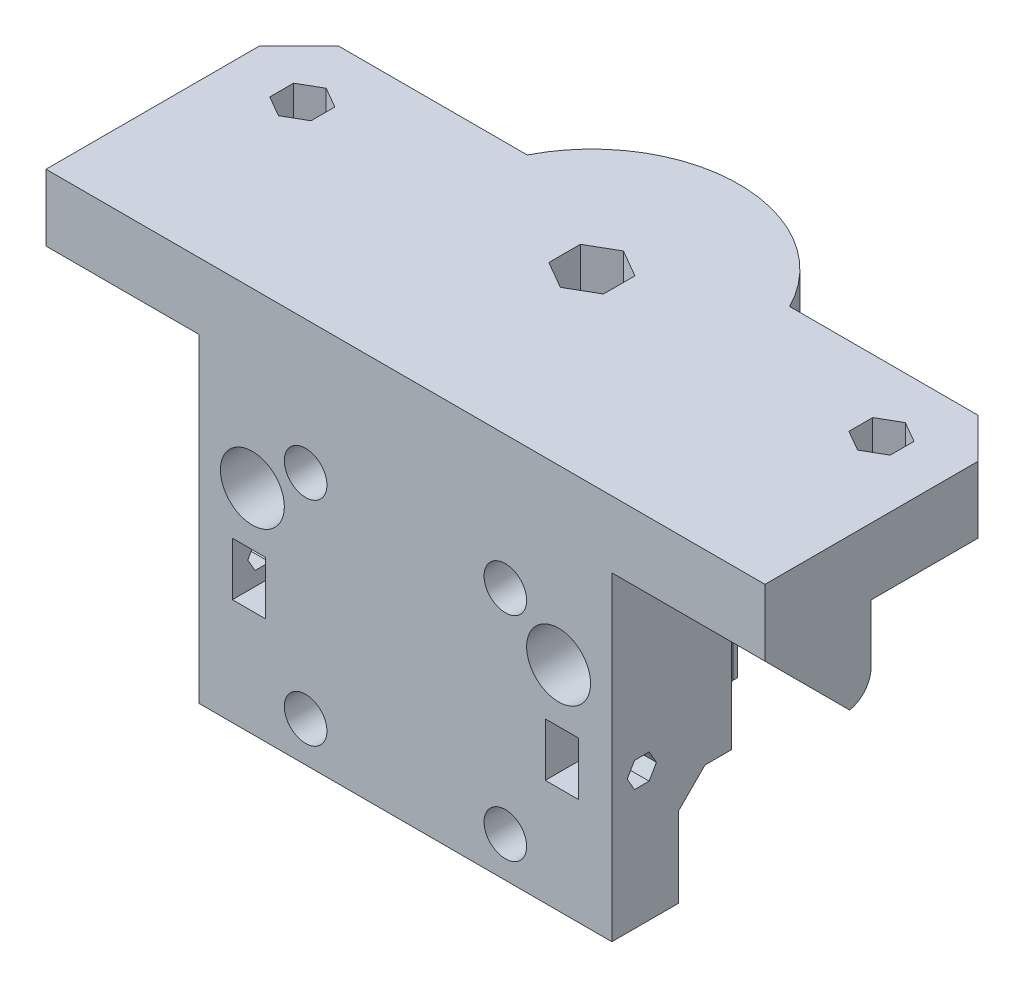
from build123d import *

# Parameters (mm, degrees)
SKETCH1_R             = 11.05
SKETCH1_R_2           = 8.05
BOSS_EXTRUDE1_DEPTH   = 7.1
BOSS_EXTRUDE2_START   = 5.9
SKETCH2_R             = 11.05
SKETCH2_R_2           = 6.05
BOSS_EXTRUDE2_DEPTH   = 5.9
BOSS_EXTRUDE3_START   = 3
SKETCH3_R             = 11.05
SKETCH3_R_2           = 8.05
BOSS_EXTRUDE3_DEPTH   = 3
BOSS_EXTRUDE5_DEPTH   = 5
BOSS_EXTRUDE6_START   = -28
BOSS_EXTRUDE6_DEPTH   = 28
SKETCH7_R             = 1.6
CUT_EXTRUDE1_DEPTH    = 10
SKETCH19_R            = 2.25
CUT_EXTRUDE12_DEPTH   = 7.2
CUT_EXTRUDE2_DEPTH    = 7
SKETCH11_W            = 69.093947153
SKETCH11_H            = 34.466141574
CUT_EXTRUDE4_DEPTH    = 35.696109338
CHAMFER_START         = -8.9
CHAMFER_1_DEPTH       = 16
CHAMFER_START_2       = -10.7999999
CHAMFER_1_2_DEPTH     = 1.8999999
CHAMFER_START_3       = -11.229918485
CHAMFER_1_3_DEPTH     = 0.429918585
CHAMFER_START_4       = 1
CHAMFER_1_4_OUTLINE_R = 1.6
CHAMFER_1_4_DEPTH     = 4
SKETCH12_R            = 1.65
CUT_EXTRUDE5_DEPTH    = 41.748159507
SKETCH13_R            = 2.4
CUT_EXTRUDE6_DEPTH    = 5.2
CUT_EXTRUDE11_DEPTH   = 2.2
SKETCH20_W            = 31
SKETCH20_H            = 7
CUT_EXTRUDE13_DEPTH   = 3
SKETCH25_W            = 11.5
SKETCH25_H            = 5
BOSS_EXTRUDE7_DEPTH   = 3.3
SKETCH_1_W            = 31
SKETCH_1_H            = 21
CUT_EXTRUDE_1_DEPTH   = 1
SKETCH_2_W            = 47.798523665
SKETCH_2_H            = 25.617179173
CUT_EXTRUDE_2_DEPTH   = 7
SKETCH_3_W            = 31
SKETCH_3_H            = 5
EXTRUDE_1_DEPTH       = 8
SKETCH_4_R            = 1.6
CUT_EXTRUDE_3_DEPTH   = 41.522987304
SKETCH_5_R            = 11.5
CUT_EXTRUDE_4_DEPTH   = 8
SKETCH_6_R            = 2.9
CUT_EXTRUDE_5_DEPTH   = 7
SKETCH_7_R            = 2.9
CUT_EXTRUDE_6_DEPTH   = 2.5
CHAMFER_2_SIZE        = 3
CHAMFER_5_SIZE        = 0.8
CHAMFER_6_SIZE        = 2
SKETCH_8_W            = 11.5
SKETCH_8_H            = 5
EXTRUDE_2_DEPTH       = 5.7
EXTRUDE_4_REACH       = 60.289
SKETCH_15_W           = 11.5
SKETCH_15_H           = 1.6
EXTRUDE_6_DEPTH       = 6.36
CUT_EXTRUDE_7_DEPTH   = 2.8
CUT_EXTRUDE_9_DEPTH   = 5
SKETCH_16_W           = 2.5
SKETCH_16_H           = 4
CUT_EXTRUDE_10_DEPTH  = 4.5
CHAMFER_8_SIZE        = 1.25
MIRROR_START          = -15.5
MIRROR_1_DEPTH        = 4.84796
MIRROR_START_2        = -19.06571985
MIRROR_1_2_DEPTH      = 3.56571985
MIRROR_START_3        = -27
MIRROR_1_3_DEPTH      = 1.9
MIRROR_START_4        = -17.06571985
MIRROR_1_4_DEPTH      = 1.56571985
MIRROR_1_5_DEPTH      = 1.9602
MIRROR_START_5        = -8.9
MIRROR_1_6_DEPTH      = 4
MIRROR_START_6        = 0.74
MIRROR_1_7_OUTLINE_W  = 5.97408015
MIRROR_1_7_OUTLINE_H  = 7.963961031
MIRROR_1_7_DEPTH      = 6.36
MIRROR_START_7        = 0.736412811
MIRROR_1_8_OUTLINE_W  = 5.97408015
MIRROR_1_8_OUTLINE_H  = 6.363961031
MIRROR_1_8_DEPTH      = 0.003587189
MIRROR_START_8        = -21.849599539
MIRROR_1_9_OUTLINE_W  = 5.97408015
MIRROR_1_9_OUTLINE_H  = 12
MIRROR_1_9_DEPTH      = 16.970562749
MIRROR_START_9        = -4.87903679
MIRROR_1_10_DEPTH     = 2.8
MIRROR_1_11_DEPTH     = 2.8
FILLET_4_R            = 2
CHAMFER_7_SIZE        = 1.8


with BuildPart() as part:
    # Sketch1 → Boss-Extrude1 (new body)
    with BuildSketch(Plane(origin=(0, 0, 0), x_dir=(1, 0, 0), z_dir=(0, 1, 0))):
        with Locations(Location((0, 0, 0), (0, 0, 270))):
            Circle(SKETCH1_R)
        with Locations(Location((0, 0, 0), (0, 0, 270))):
            Circle(SKETCH1_R_2, mode=Mode.SUBTRACT)
    extrude(amount=BOSS_EXTRUDE1_DEPTH)

    # Sketch2 → Boss-Extrude2 (add)
    with BuildSketch(Plane(origin=(0, 0, 0), x_dir=(-1, 0, 0), z_dir=(0, -1, 0)).offset(BOSS_EXTRUDE2_START)):
        with Locations(Location((0, 0, 0), (0, 0, 90))):
            Circle(SKETCH2_R)
        with Locations(Location((0, 0, 0), (0, 0, 90))):
            Circle(SKETCH2_R_2, mode=Mode.SUBTRACT)
    extrude(amount=-BOSS_EXTRUDE2_DEPTH)

    # Sketch3 → Boss-Extrude3 (add)
    with BuildSketch(Plane(origin=(0, -5.9, 0), x_dir=(-1, 0, 0), z_dir=(0, -1, 0)).offset(BOSS_EXTRUDE3_START)):
        with Locations(Location((0, 0, 0), (0, 0, 90))):
            Circle(SKETCH3_R)
        with Locations(Location((0, 0, 0), (0, 0, 270))):
            Circle(SKETCH3_R_2, mode=Mode.SUBTRACT)
    extrude(amount=-BOSS_EXTRUDE3_DEPTH)

    # Sketch5 → Boss-Extrude5 (add)
    with BuildSketch(Plane(origin=(0, 7.1, 0), x_dir=(1, 0, 0), z_dir=(0, 1, 0))):
        with BuildLine():
            Line((27, 5), (9.854060077, 5))
            ThreePointArc((9.854060077, 5), (0, 11.05), (-9.854060077, 5))
            Line((-9.854060077, 5), (-27, 5))
            Line((-27, 5), (-27, -5))
            Line((-27, -5), (-9.854060077, -5))
            ThreePointArc((-9.854060077, -5), (0, -11.05), (9.854060077, -5))
            Line((9.854060077, -5), (27, -5))
            Line((27, -5), (27, 5))
        make_face()
        Polygon((23.3, 0.894892917), (23.3, -0.894892917), (21.75, -1.789785834), (20.2, -0.894892917), (20.2, 0.894892917), (21.75, 1.789785834), align=None, mode=Mode.SUBTRACT)
        Polygon((0, -2.367136104), (-2.05, -1.183568052), (-2.05, 1.183568052), (0, 2.367136104), (2.05, 1.183568052), (2.05, -1.183568052), align=None, mode=Mode.SUBTRACT)
        Polygon((-20.2, 0.894892917), (-20.2, -0.894892917), (-21.75, -1.789785834), (-23.3, -0.894892917), (-23.3, 0.894892917), (-21.75, 1.789785834), align=None, mode=Mode.SUBTRACT)
    extrude(amount=BOSS_EXTRUDE5_DEPTH)

    # Sketch6 → Boss-Extrude6 (add)
    with BuildSketch(Plane(origin=(0, 12.1, 0), x_dir=(1, 0, 0), z_dir=(0, 1, 0)).offset(BOSS_EXTRUDE6_START)):
        with BuildLine():
            Line((-15.5, -5), (-9.854060077, -5))
            ThreePointArc((-9.854060077, -5), (0, -11.05), (9.854060077, -5))
            Line((9.854060077, -5), (15.5, -5))
            Line((15.5, -5), (15.5, -15))
            Line((15.5, -15), (-15.5, -15))
            Line((-15.5, -15), (-15.5, -5))
        make_face()
    extrude(amount=BOSS_EXTRUDE6_DEPTH)

    # Sketch7 → Cut-Extrude1 (cut)
    with BuildSketch(Plane.XY.offset(15)):
        with Locations((-12, -12.4)):
            Circle(SKETCH7_R)
        with Locations((12, -12.4)):
            Circle(SKETCH7_R)
    extrude(amount=-CUT_EXTRUDE1_DEPTH, mode=Mode.SUBTRACT)

    # Sketch19 → Cut-Extrude12 (cut)
    with BuildSketch(Plane.XY.offset(15)):
        with Locations((-12, -12.4)):
            Circle(SKETCH19_R)
        with Locations((12, -12.4)):
            Circle(SKETCH19_R)
    extrude(amount=-CUT_EXTRUDE12_DEPTH, mode=Mode.SUBTRACT)

    # Sketch8 → Cut-Extrude2 (cut)
    with BuildSketch(Plane(origin=(0, -15.9, 0), x_dir=(-1, 0, 0), z_dir=(0, -1, 0))):
        with BuildLine():
            Line((-8, -8.94427191), (-8, -15))
            Line((-8, -15), (8, -15))
            Line((8, -15), (8, -8.94427191))
            ThreePointArc((8, -8.94427191), (0, -12), (-8, -8.94427191))
        make_face()
        with BuildLine():
            Line((-8, -7.62249959), (-8, -8.94427191))
            ThreePointArc((-8, -8.94427191), (0, -12), (8, -8.94427191))
            Line((8, -8.94427191), (8, -7.62249959))
            ThreePointArc((8, -7.62249959), (0, -11.05), (-8, -7.62249959))
        make_face()
        with BuildLine():
            Line((-8, -5), (-8, -7.62249959))
            ThreePointArc((-8, -7.62249959), (0, -11.05), (8, -7.62249959))
            Line((8, -7.62249959), (8, -5))
            Line((8, -5), (-8, -5))
        make_face()
        with BuildLine():
            ThreePointArc((-10.908712115, -5), (-9.657855284, -7.122206913), (-8, -8.94427191))
            Line((-8, -8.94427191), (-8, -7.62249959))
            ThreePointArc((-8, -7.62249959), (-9.022817816, -6.378970032), (-9.854060077, -5))
            Line((-9.854060077, -5), (-10.908712115, -5))
        make_face()
        with BuildLine():
            Line((8, -7.62249959), (8, -8.94427191))
            ThreePointArc((8, -8.94427191), (9.657855284, -7.122206913), (10.908712115, -5))
            Line((10.908712115, -5), (9.854060077, -5))
            ThreePointArc((9.854060077, -5), (9.022817816, -6.378970032), (8, -7.62249959))
        make_face()
    extrude(amount=-CUT_EXTRUDE2_DEPTH, mode=Mode.SUBTRACT)

    # Sketch11 → Cut-Extrude4 (cut, through all)
    with BuildSketch(Plane.XY.offset(0.1)):
        with Locations((-0.795033035, -10.133070787)):
            Rectangle(SKETCH11_W, SKETCH11_H)
    extrude(amount=-CUT_EXTRUDE4_DEPTH, mode=Mode.SUBTRACT)

    # 倒角1: read off the stored shape, not the designer's step
    # 倒角1 outline → 倒角1 (add)
    with BuildSketch(Plane(origin=(0, 0, 0), x_dir=(1, 0, 0), z_dir=(0, 1, 0)).offset(CHAMFER_START)):
        with BuildLine():
            Line((12.999631207, -5), (11.040598985, -0.455712685))
            ThreePointArc((11.040598985, -0.455712685), (10.691554196, -2.791624773), (9.854060077, -5))
            Line((9.854060077, -5), (12.999631207, -5))
        make_face()
        with BuildLine():
            ThreePointArc((-9.854060077, -5), (-10.441635038, -3.615903448), (-10.835862618, -2.164851341))
            Line((-10.835862618, -2.164851341), (-15.21279225, -5))
            Line((-15.21279225, -5), (-9.854060077, -5))
        make_face()
    extrude(amount=CHAMFER_1_DEPTH)

    # Chamfer 1 2 outline → Chamfer 1 2 (add)
    with BuildSketch(Plane(origin=(0, 0, 0), x_dir=(1, 0, 0), z_dir=(0, 1, 0)).offset(CHAMFER_START_2)):
        with BuildLine():
            Line((12.999631207, -5), (11.795384696, -2.206558379))
            ThreePointArc((11.795384696, -2.206558379), (11.43764976, -3.630450108), (10.908712115, -5))
            Line((10.908712115, -5), (12.999631207, -5))
        make_face()
    extrude(amount=CHAMFER_1_2_DEPTH)

    # Chamfer 1 3 outline → Chamfer 1 3 (add)
    with BuildSketch(Plane(origin=(0, 0, 0), x_dir=(1, 0, 0), z_dir=(0, 1, 0)).offset(CHAMFER_START_3)):
        with BuildLine():
            Line((12.999631207, -5), (11.795384696, -2.206558379))
            ThreePointArc((11.795384696, -2.206558379), (11.43764976, -3.630450108), (10.908712115, -5))
            Line((10.908712115, -5), (12.999631207, -5))
        make_face()
    extrude(amount=CHAMFER_1_3_DEPTH)

    # Chamfer 1 4 outline → Chamfer 1 4 (cut)
    with BuildSketch(Plane.XY.offset(CHAMFER_START_4)):
        with Locations((12, -12.4)):
            Circle(CHAMFER_1_4_OUTLINE_R)
    extrude(amount=CHAMFER_1_4_DEPTH, mode=Mode.SUBTRACT)

    # Sketch12 → Cut-Extrude5 (cut, through all)
    with BuildSketch(Plane.XY.offset(15)):
        with Locations((-11.5, -0.9)):
            Circle(SKETCH12_R)
        with Locations((11.5, -0.9)):
            Circle(SKETCH12_R)
    extrude(amount=-CUT_EXTRUDE5_DEPTH, mode=Mode.SUBTRACT)

    # Sketch13 → Cut-Extrude6 (cut)
    with BuildSketch(Plane.XY.offset(15)):
        with Locations((-11.5, -0.9)):
            Circle(SKETCH13_R)
        with Locations((11.5, -0.9)):
            Circle(SKETCH13_R)
    extrude(amount=-CUT_EXTRUDE6_DEPTH, mode=Mode.SUBTRACT)

    # Sketch18 → Cut-Extrude11 (cut)
    with BuildSketch(Plane(origin=(0, 7.1, 0), x_dir=(-1, 0, 0), z_dir=(0, -1, 0))):
        Polygon((-18.95, 1.616580754), (-21.75, 3.233161507), (-24.55, 1.616580754), (-24.55, -1.616580754), (-21.75, -3.233161507), (-18.95, -1.616580754), align=None)
        Polygon((24.55, -1.678715419), (24.55, 1.554446088), (21.75, 3.171026842), (18.95, 1.554446088), (18.95, -1.678715419), (21.75, -3.295296173), align=None)
    extrude(amount=-CUT_EXTRUDE11_DEPTH, mode=Mode.SUBTRACT)

    # Sketch20 → Cut-Extrude13 (cut)
    with BuildSketch(Plane.XY.offset(15)):
        with Locations((0, -12.4)):
            Rectangle(SKETCH20_W, SKETCH20_H)
    extrude(amount=-CUT_EXTRUDE13_DEPTH, mode=Mode.SUBTRACT)

    # Sketch25 → Boss-Extrude7 (add)
    with BuildSketch(Plane.XY.offset(5)):
        with Locations((21.25, 9.6)):
            Rectangle(SKETCH25_W, SKETCH25_H)
        with Locations((-21.25, 9.6)):
            Rectangle(SKETCH25_W, SKETCH25_H)
    extrude(amount=BOSS_EXTRUDE7_DEPTH)

    # 草图1 → 切除-拉伸1 (cut)
    with BuildSketch(Plane.XY.offset(15)):
        with Locations((0, 1.6)):
            Rectangle(SKETCH_1_W, SKETCH_1_H)
    extrude(amount=-CUT_EXTRUDE_1_DEPTH, mode=Mode.SUBTRACT)

    # 草图2 → 切除-拉伸2 (cut)
    with BuildSketch(Plane(origin=(0, -15.9, 0), x_dir=(-1, 0, 0), z_dir=(0, -1, 0))):
        with Locations((-1.111593574, -6.563303387)):
            Rectangle(SKETCH_2_W, SKETCH_2_H)
    extrude(amount=-CUT_EXTRUDE_2_DEPTH, mode=Mode.SUBTRACT)

    # 草图3 → 凸台-拉伸1 (add)
    with BuildSketch(Plane(origin=(0, -8.9, 0), x_dir=(-1, 0, 0), z_dir=(0, -1, 0))):
        with Locations((0, -11.5)):
            Rectangle(SKETCH_3_W, SKETCH_3_H)
    extrude(amount=EXTRUDE_1_DEPTH)

    # 草图4 → 切除-拉伸3 (cut, through all)
    with BuildSketch(Plane.XY.offset(14)):
        with Locations((-7.5, 2.1)):
            Circle(SKETCH_4_R)
        with Locations((7.5, 2.1)):
            Circle(SKETCH_4_R)
        with Locations((7.5, -13.9)):
            Circle(SKETCH_4_R)
        with Locations((-7.5, -13.9)):
            Circle(SKETCH_4_R)
    extrude(amount=-CUT_EXTRUDE_3_DEPTH, mode=Mode.SUBTRACT)

    # 草图5 → 切除-拉伸4 (cut)
    with BuildSketch(Plane(origin=(0, -16.9, 0), x_dir=(-1, 0, 0), z_dir=(0, -1, 0))):
        Circle(SKETCH_5_R)
    extrude(amount=-CUT_EXTRUDE_4_DEPTH, mode=Mode.SUBTRACT)

    # 草图6 → 切除-拉伸5 (cut)
    with BuildSketch(Plane(origin=(0, 0, 0.1), x_dir=(-1, 0, 0), z_dir=(0, 0, -1))):
        with Locations((7.5, 2.1)):
            Circle(SKETCH_6_R)
        with Locations((-7.5, 2.1)):
            Circle(SKETCH_6_R)
    extrude(amount=-CUT_EXTRUDE_5_DEPTH, mode=Mode.SUBTRACT)

    # 草图7 → 切除-拉伸6 (cut)
    with BuildSketch(Plane(origin=(0, 0, 9), x_dir=(-1, 0, 0), z_dir=(0, 0, -1))):
        with Locations((-7.5, -13.9)):
            Circle(SKETCH_7_R)
        with Locations((7.5, -13.9)):
            Circle(SKETCH_7_R)
    extrude(amount=-CUT_EXTRUDE_6_DEPTH, mode=Mode.SUBTRACT)

    # 倒角2
    chamfer_2_edges = [part.edges().sort_by_distance(p)[0] for p in [
        (-27, 9.6, -5),
        (27, 9.6, -5),
    ]]
    chamfer(chamfer_2_edges, length=CHAMFER_2_SIZE)

    # 倒角5
    # the kernel refuses this chamfer: 0.8 mm, written as the material it takes off along each edge
    with BuildSketch(Plane(origin=(-11.5, -0.9, 9.8), x_dir=(1, 0, 0), z_dir=(0, -1, 0))) as chamfer_5_piece_1_section:
        Polygon((1.65, -CHAMFER_5_SIZE), (1.65 + CHAMFER_5_SIZE, 0), (1.65, 0), align=None)
    chamfer_5_piece_1 = revolve(axis=Axis((-11.5, -0.9, 9.8), (0, 0, 1)), mode=Mode.PRIVATE)
    chamfer_5_piece_1 = chamfer_5_piece_1 & Plane(origin=(-11.5, -0.9, 9.8), x_dir=(1, 0, 0), z_dir=(0, 0, 1)) * Cylinder(2.4, 10, mode=Mode.PRIVATE)
    add(chamfer_5_piece_1, mode=Mode.SUBTRACT)
    with BuildSketch(Plane(origin=(11.5, -0.9, 9.8), x_dir=(1, 0, 0), z_dir=(0, -1, 0))) as chamfer_5_piece_2_section:
        Polygon((1.65, -CHAMFER_5_SIZE), (1.65 + CHAMFER_5_SIZE, 0), (1.65, 0), align=None)
    chamfer_5_piece_2 = revolve(axis=Axis((11.5, -0.9, 9.8), (0, 0, 1)), mode=Mode.PRIVATE)
    chamfer_5_piece_2 = chamfer_5_piece_2 & Plane(origin=(11.5, -0.9, 9.8), x_dir=(1, 0, 0), z_dir=(0, 0, 1)) * Cylinder(2.4, 10, mode=Mode.PRIVATE)
    add(chamfer_5_piece_2, mode=Mode.SUBTRACT)

    # 倒角6
    chamfer_6_edges = [part.edges().sort_by_distance(p)[0] for p in [
        (-11.329455266, -8.9, 9),
        (11.329455266, -8.9, 9),
    ]]
    chamfer(chamfer_6_edges, length=CHAMFER_6_SIZE)

    # 草图8 → 凸台-拉伸2 (add)
    with BuildSketch(Plane.XY.offset(8.3)):
        with Locations((21.25, 9.6)):
            Rectangle(SKETCH_8_W, SKETCH_8_H)
        with Locations((-21.25, 9.6)):
            Rectangle(SKETCH_8_W, SKETCH_8_H)
    extrude(amount=EXTRUDE_2_DEPTH)

    # 草图10 → 凸台-拉伸4 (add, up to next)
    with BuildSketch(Plane(origin=(27, 0, 0), x_dir=(0, 0, -1), z_dir=(1, 0, 0)), mode=Mode.PRIVATE) as extrude_4_sk1:
        Polygon((-14, 7.1), (-7.636038969, 0.736038969), (-7.636038969, 7.1), align=None)
    extrude_4_tool1 = extrude(extrude_4_sk1.sketch, amount=-EXTRUDE_4_REACH, mode=Mode.PRIVATE) - part.part
    add(extrude_4_tool1.solids().sort_by_distance((27, 4.97868, 9.757359))[0])

    # 草图15 → 凸台-拉伸6 (add)
    with BuildSketch(Plane(origin=(0, 7.1, 0), x_dir=(-1, 0, 0), z_dir=(0, -1, 0))):
        with Locations((-21.25, -6.836038969)):
            Rectangle(SKETCH_15_W, SKETCH_15_H)
    extrude(amount=EXTRUDE_6_DEPTH)

    # 草图11 → 切除-拉伸7 (cut)
    with BuildSketch(Plane(origin=(0, -3.45, 3.45), x_dir=(-1, 0, 0), z_dir=(0, -0.7071067811865562, 0.7071067811865389))):
        with BuildLine():
            Line((-19.06571985, -9.919953083), (-17.06571985, -9.919953083))
            Line((-17.06571985, -9.919953083), (-17.06571985, -11.919953083))
            Line((-17.06571985, -11.919953083), (-19.06571985, -11.919953083))
            ThreePointArc((-19.06571985, -11.919953083), (-25.1, -10.919953083), (-19.06571985, -9.919953083))
        make_face()
    extrude(amount=-CUT_EXTRUDE_7_DEPTH, mode=Mode.SUBTRACT)

    # 草图14 → 切除-拉伸9 (cut)
    with BuildSketch(Plane(origin=(15.5, 0, 0), x_dir=(0, 0, -1), z_dir=(1, 0, 0))):
        Polygon((-10.653034489, -6.9), (-11.201517244, -5.95), (-12.298482756, -5.95), (-12.846965511, -6.9), (-12.298482756, -7.85), (-11.201517244, -7.85), align=None)
    extrude(amount=-CUT_EXTRUDE_9_DEPTH, mode=Mode.SUBTRACT)

    # 草图16 → 切除-拉伸10 (cut)
    with BuildSketch(Plane.XY.offset(14)):
        with Locations((11.75, -6.9)):
            Rectangle(SKETCH_16_W, SKETCH_16_H)
    extrude(amount=-CUT_EXTRUDE_10_DEPTH, mode=Mode.SUBTRACT)

    # 倒角8
    # the kernel refuses this chamfer: 1.25 mm, written as the material it adds along each edge
    with BuildSketch(Plane(origin=(10.5, -12.114603735, 9.5), x_dir=(0, 0, 1), z_dir=(0, 1, 0))) as chamfer_8_piece_1:
        Polygon((CHAMFER_8_SIZE, 0), (0, CHAMFER_8_SIZE), (0, 0), align=None)
    extrude(amount=7.214603735)
    with BuildSketch(Plane(origin=(13, -4.9, 9.5), x_dir=(0, 0, 1), z_dir=(0, -1, 0))) as chamfer_8_piece_2_section:
        Polygon((CHAMFER_8_SIZE, 0), (0, CHAMFER_8_SIZE), (0, 0), align=None)
    chamfer_8_piece_2 = extrude(amount=7.214603735, mode=Mode.PRIVATE)
    chamfer_8_piece_2 = split(chamfer_8_piece_2, bisect_by=Plane(origin=(13, -5.899278579, 11.23080127), z_dir=(0, 0.5000000000000002, -0.8660254037844386)), keep=Keep.TOP, mode=Mode.PRIVATE)
    add(chamfer_8_piece_2)
    with BuildSketch(Plane(origin=(13, -1.685396265, 9.5), x_dir=(0, 0, 1), z_dir=(0, -1, 0))) as chamfer_8_piece_3_section:
        Polygon((CHAMFER_8_SIZE, 0), (0, CHAMFER_8_SIZE), (0, 0), align=None)
    chamfer_8_piece_3 = extrude(amount=10.42920747, mode=Mode.PRIVATE)
    chamfer_8_piece_3 = split(chamfer_8_piece_3, bisect_by=Plane(origin=(13, -2.48976862, 8.106786214), z_dir=(0, -0.49999999999999895, -0.8660254037844393)), keep=Keep.TOP, mode=Mode.PRIVATE)
    add(chamfer_8_piece_3)

    # 镜向1: read off the stored shape, not the designer's step
    # 镜向1 outline → 镜向1 (cut)
    with BuildSketch(Plane.YZ.offset(MIRROR_START)):
        Polygon((-7.85, 11.201517244), (-6.9, 10.653034489), (-5.95, 11.201517244), (-5.95, 12.298482756), (-6.9, 12.846965511), (-7.85, 12.298482756), align=None)
    extrude(amount=MIRROR_1_DEPTH, mode=Mode.SUBTRACT)

    # Mirror 1 2 outline → Mirror 1 2 (add)
    with BuildSketch(Plane.YZ.offset(MIRROR_START_2)):
        Polygon((3.564466094, 10.464466094), (0.736038969, 7.636038969), (0.74, 7.636038969), (0.74, 6.036038969), (7.1, 6.036038969), (7.1, 14), (4.978679656, 11.878679656), (6.958578644, 9.898780669), (5.544365081, 8.484567107), align=None)
    extrude(amount=MIRROR_1_2_DEPTH)

    # Mirror 1 3 outline → Mirror 1 3 (add)
    with BuildSketch(Plane.YZ.offset(MIRROR_START_3)):
        Polygon((0.736038969, 7.636038969), (0.74, 7.636038969), (0.74, 6.036038969), (7.1, 6.036038969), (7.1, 14), align=None)
    extrude(amount=MIRROR_1_3_DEPTH)

    # Mirror 1 4 outline → Mirror 1 4 (add)
    with BuildSketch(Plane.YZ.offset(MIRROR_START_4)):
        Polygon((4.978679656, 11.878679656), (3.564466094, 10.464466094), (5.544365081, 8.484567107), (6.958578644, 9.898780669), align=None)
    extrude(amount=MIRROR_1_4_DEPTH)

    # Mirror 1 5 outline → Mirror 1 5 (add)
    with BuildSketch(Plane.YZ.offset(MIRROR_START_3)):
        Polygon((3.564466094, 10.464466094), (0.736038969, 7.636038969), (0.74, 7.636038969), (0.74, 6.036038969), (7.1, 6.036038969), (7.1, 14), (4.978679656, 11.878679656), (6.958578644, 9.898780669), (5.544365081, 8.484567107), align=None)
    extrude(amount=MIRROR_1_5_DEPTH)

    # Mirror 1 6 outline → Mirror 1 6 (cut)
    with BuildSketch(Plane(origin=(0, 0, 0), x_dir=(1, 0, 0), z_dir=(0, 1, 0)).offset(MIRROR_START_5)):
        Polygon((-13, -10.75), (-13, -14), (-10.5, -14), (-10.5, -10.75), (-11.75, -9.5), align=None)
    extrude(amount=MIRROR_1_6_DEPTH, mode=Mode.SUBTRACT)

    # Mirror 1 7 outline → Mirror 1 7 (add)
    with BuildSketch(Plane(origin=(0, 0, 0), x_dir=(1, 0, 0), z_dir=(0, 1, 0)).offset(MIRROR_START_6)):
        with Locations((-22.052759925, -10.018019484)):
            Rectangle(MIRROR_1_7_OUTLINE_W, MIRROR_1_7_OUTLINE_H)
    extrude(amount=MIRROR_1_7_DEPTH)

    # Mirror 1 8 outline → Mirror 1 8 (add)
    with BuildSketch(Plane(origin=(0, 0, 0), x_dir=(1, 0, 0), z_dir=(0, 1, 0)).offset(MIRROR_START_7)):
        with Locations((-22.052759925, -10.818019485)):
            Rectangle(MIRROR_1_8_OUTLINE_W, MIRROR_1_8_OUTLINE_H)
    extrude(amount=MIRROR_1_8_DEPTH)

    # Mirror 1 9 outline → Mirror 1 9 (cut)
    with BuildSketch(Plane(origin=(0, 0, 0), x_dir=(1, 0, 0), z_dir=(0, 0.707106781186556, -0.707106781186539)).offset(MIRROR_START_8)):
        with Locations((-22.052759925, -10)):
            Rectangle(MIRROR_1_9_OUTLINE_W, MIRROR_1_9_OUTLINE_H)
    extrude(amount=MIRROR_1_9_DEPTH, mode=Mode.SUBTRACT)

    # Mirror 1 10 outline → Mirror 1 10 (cut)
    with BuildSketch(Plane(origin=(0, 0, 0), x_dir=(1, 0, 0), z_dir=(0, 0.707106781186556, -0.707106781186539)).offset(MIRROR_START_9)):
        with BuildLine():
            ThreePointArc((-25.0398, -11.527913575), (-22.202995945, -14.013299595), (-19.06571985, -11.919953083))
            Line((-19.06571985, -11.919953083), (-19.06571985, -9.919953083))
            ThreePointArc((-19.06571985, -9.919953083), (-22.202995945, -7.826606571), (-25.0398, -10.311992591))
            Line((-25.0398, -10.311992591), (-25.0398, -11.527913575))
        make_face()
    extrude(amount=MIRROR_1_10_DEPTH, mode=Mode.SUBTRACT)

    # Mirror 1 11 outline → Mirror 1 11 (add)
    with BuildSketch(Plane(origin=(0, 0, 0), x_dir=(1, 0, 0), z_dir=(0, 0.707106781186556, -0.707106781186539)).offset(MIRROR_START_9)):
        with BuildLine():
            Line((-25.0398, -11.919953082), (-25.0398, -11.527913575))
            ThreePointArc((-25.0398, -11.527913575), (-25.084913289, -11.225419939), (-25.1, -10.919953083))
            Line((-25.1, -10.919953083), (-25.1, -11.919953083))
            Line((-25.1, -11.919953083), (-25.0398, -11.919953082))
        make_face()
        with BuildLine():
            Line((-25.1, -9.919953083), (-25.1, -10.919953083))
            ThreePointArc((-25.1, -10.919953083), (-25.084913289, -10.614486227), (-25.0398, -10.311992591))
            Line((-25.0398, -10.311992591), (-25.0398, -9.919953083))
            Line((-25.0398, -9.919953083), (-25.1, -9.919953083))
        make_face()
    extrude(amount=MIRROR_1_11_DEPTH)

    # 圆角4
    # the kernel refuses this fillet: 2 mm, written as the material it takes off along each edge
    with BuildSketch(Plane(origin=(-15.5, 0.74, 6.036038969), x_dir=(0, 1, 0), z_dir=(-1, 0, 0)), Plane(origin=(31.898979486, 0.74, 6.036038969), x_dir=(0, 1, 0), z_dir=(-1, 0, 0))) as fillet_4_piece_1:
        with BuildLine():
            CenterArc((1.959591794, -2), FILLET_4_R, 90, 78.463040967)
            Line((0, -1.6), (-0.039191836, -1.592))
            ThreePointArc((-0.039191836, -1.592), (-0.04, -0.8), (-0.04, 0))
            Line((-0.04, 0), (0, 0.04))
            Line((0, 0.04), (1.959591794, 0.04))
            Line((1.959591794, 0.04), (1.959591794, 0))
        make_face()
    extrude(amount=16.398979486, mode=Mode.SUBTRACT)

    # 倒角7
    chamfer_7_edges = [part.edges().sort_by_distance(p)[0] for p in [
        (17.06571985, 6.251471863, 9.191673888),
        (-17.06571985, 6.251471862, 9.191673888),
    ]]
    chamfer(chamfer_7_edges, length=CHAMFER_7_SIZE)


solid = part.part
